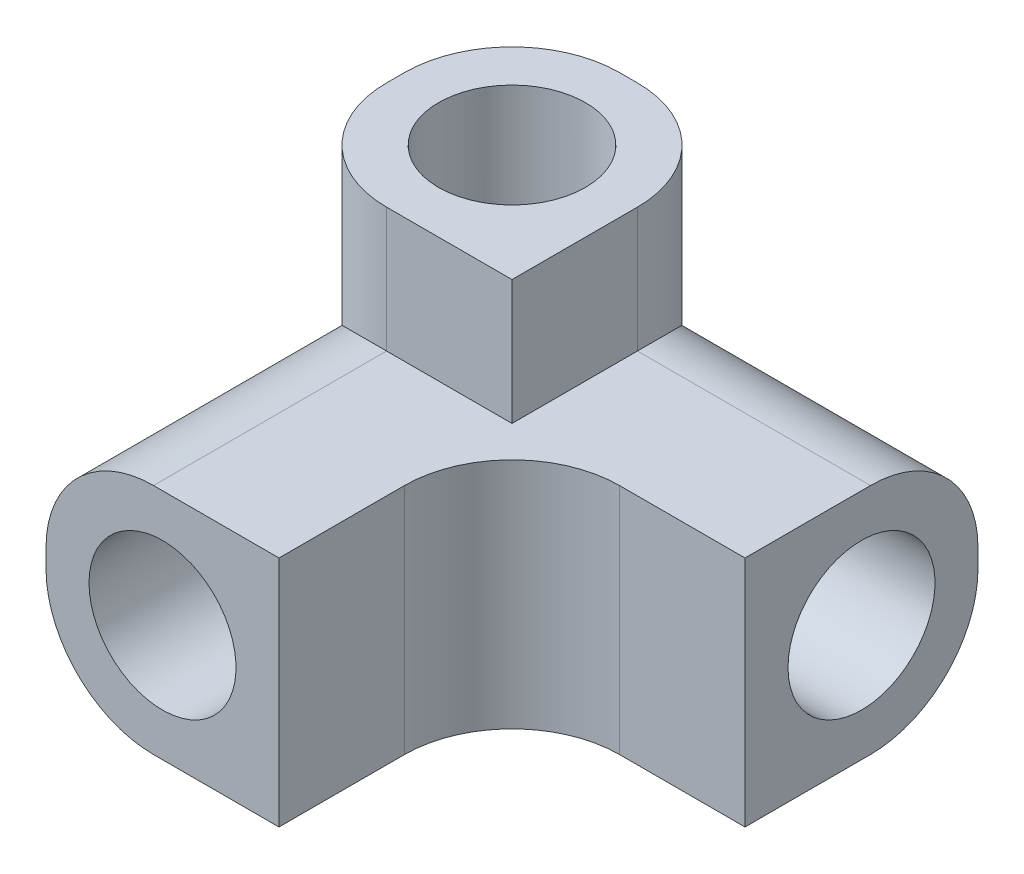
from build123d import *

# Parameters (mm, degrees)
SKETCH_1_W               = 6.5
SKETCH_1_H               = 6.5
SKETCH_1_R               = 2.05
EXTRUDE_1_DEPTH          = 6.5
SKETCH_2_W               = 6.5
SKETCH_2_H               = 13
EXTRUDE_2_DEPTH          = 6.5
SKETCH_3_W               = 6.5
SKETCH_3_H               = 6.5
SKETCH_3_R               = 2.05
EXTRUDE_3_DEPTH          = 6.5
SKETCH_4_R               = 2.05
CUT_EXTRUDE_1_DEPTH      = 8
FILLET_1_R               = 3
FILLET_2_R               = 3
CUT_EXTRUDE_2_DEPTH      = 18.195428818
CUT_EXTRUDE_2_DEPTH_BACK = 18.195428818
SKETCH_5_W               = 7.542755484
SKETCH_5_H               = 3.936219418


with BuildPart() as part:
    # 草图1 → 凸台-拉伸1 (new body)
    with BuildSketch(Plane.XY):
        with Locations((-8.580694703, 4.782128964)):
            Rectangle(SKETCH_1_W, SKETCH_1_H)
        with Locations(Location((-8.580694703, 4.782128964, 0), (0, 0, 180))):
            Circle(SKETCH_1_R, mode=Mode.SUBTRACT)
    extrude(amount=EXTRUDE_1_DEPTH)

    # 草图2 → 凸台-拉伸2 (add)
    with BuildSketch(Plane(origin=(-5.330694703, 0, 0), x_dir=(0, 0, -1), z_dir=(1, 0, 0))):
        with Locations((3.25, 8.032128964)):
            Rectangle(SKETCH_2_W, SKETCH_2_H)
    extrude(amount=-EXTRUDE_2_DEPTH)

    # 草图3 → 凸台-拉伸3 (add)
    with BuildSketch(Plane(origin=(-5.330694703, 0, 0), x_dir=(0, 0, -1), z_dir=(1, 0, 0))):
        with Locations((3.25, 4.782128964)):
            Rectangle(SKETCH_3_W, SKETCH_3_H)
        with Locations(Location((3.25, 4.782128964, 0), (0, 0, 180))):
            Circle(SKETCH_3_R, mode=Mode.SUBTRACT)
    extrude(amount=EXTRUDE_3_DEPTH)

    # 草图4 → 切除-拉伸1 (cut)
    with BuildSketch(Plane(origin=(0, 14.532128964, 0), x_dir=(1, 0, 0), z_dir=(0, 1, 0))):
        with Locations(Location((-8.580694703, 3.25, 0), (0, 0, 270))):
            Circle(SKETCH_4_R)
    extrude(amount=-CUT_EXTRUDE_1_DEPTH, mode=Mode.SUBTRACT)

    # 圆角1
    fillet_1_edges = [part.edges().sort_by_distance(p)[0] for p in [
        (-5.330694703, 1.532128964, -6.5),
        (-11.830694703, 11.282128964, 0),
        (-11.830694703, 8.032128964, -6.5),
        (-5.330694703, 11.282128964, -6.5),
        (-2.080694703, 8.032128964, -6.5),
        (-11.830694703, 1.532128964, 0),
        (-11.830694703, 8.032128964, 3.25),
    ]]
    fillet(fillet_1_edges, radius=FILLET_1_R)

    # 圆角2
    # the kernel refuses this fillet: 3 mm, written as the material it adds along each edge
    with BuildSketch(Plane(origin=(-5.330694703, 1.532128964, 0), x_dir=(0, 0, 1), z_dir=(0, 1, 0))) as fillet_2_piece_1:
        with BuildLine():
            CenterArc((FILLET_2_R, FILLET_2_R), FILLET_2_R, 180, 90)
            Line((0, FILLET_2_R), (0, 0))
            Line((0, 0), (FILLET_2_R, 0))
        make_face()
    extrude(amount=6.5)

    # 草图5 → 切除-拉伸2 (cut, two sides: drawn at the far end of the back side and taken through both)
    with BuildSketch(Plane(origin=(-5.330694703, 0, 0), x_dir=(0, 0, -1), z_dir=(1, 0, 0)).offset(-CUT_EXTRUDE_2_DEPTH_BACK)):
        with Locations((3.771377742, 13.476899479)):
            Rectangle(SKETCH_5_W, SKETCH_5_H)
    extrude(amount=CUT_EXTRUDE_2_DEPTH + CUT_EXTRUDE_2_DEPTH_BACK, mode=Mode.SUBTRACT)


solid = part.part
